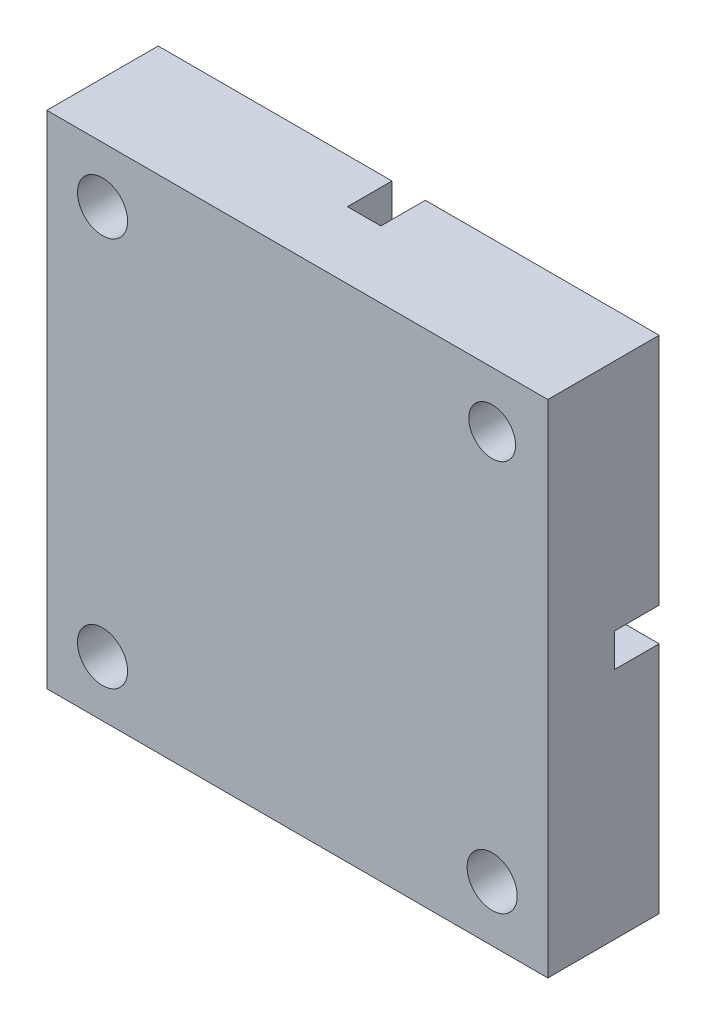
from build123d import *

# Parameters (mm, degrees)
SKETCH1_W           = 45
SKETCH1_H           = 45
SKETCH1_R           = 2.25
SKETCH1_R_2         = 2.1
BOSS_EXTRUDE1_DEPTH = 10
CUT_EXTRUDE1_DEPTH  = 5
CUT_EXTRUDE2_DEPTH  = 4


with BuildPart() as part:
    # Sketch1 → Boss-Extrude1 (new body)
    with BuildSketch(Plane.XY):
        with Locations((22.5, 22.5)):
            Rectangle(SKETCH1_W, SKETCH1_H)
        with Locations((5, 5)):
            Circle(SKETCH1_R, mode=Mode.SUBTRACT)
        with Locations((5, 40)):
            Circle(SKETCH1_R, mode=Mode.SUBTRACT)
        with Locations((40, 40)):
            Circle(SKETCH1_R_2, mode=Mode.SUBTRACT)
        with Locations((40, 5)):
            Circle(SKETCH1_R, mode=Mode.SUBTRACT)
    extrude(amount=BOSS_EXTRUDE1_DEPTH)

    # Sketch2 → Cut-Extrude1 (cut)
    with BuildSketch(Plane.XY):
        Polygon((8.75277675, 5), (6.876388375, 8.25), (3.123611625, 8.25), (1.24722325, 5), (3.123611625, 1.75), (6.876388375, 1.75), align=None)
        Polygon((8.75277675, 40), (6.876388375, 43.25), (3.123611625, 43.25), (1.24722325, 40), (3.123611625, 36.75), (6.876388375, 36.75), align=None)
        Polygon((43.75277675, 40), (41.876388375, 43.25), (38.123611625, 43.25), (36.24722325, 40), (38.123611625, 36.75), (41.876388375, 36.75), align=None)
        Polygon((43.75277675, 5), (41.876388375, 8.25), (38.123611625, 8.25), (36.24722325, 5), (38.123611625, 1.75), (41.876388375, 1.75), align=None)
    extrude(amount=CUT_EXTRUDE1_DEPTH, mode=Mode.SUBTRACT)

    # Sketch3 → Cut-Extrude2 (cut)
    with BuildSketch(Plane(origin=(0, 0, 0), x_dir=(-1, 0, 0), z_dir=(0, 0, -1))):
        Polygon((-45, 24), (-24, 24), (-24, 45), (-21, 45), (-21, 24), (0, 24), (0, 21), (-21, 21), (-21, 0), (-24, 0), (-24, 21), (-45, 21), align=None)
    extrude(amount=-CUT_EXTRUDE2_DEPTH, mode=Mode.SUBTRACT)


solid = part.part
